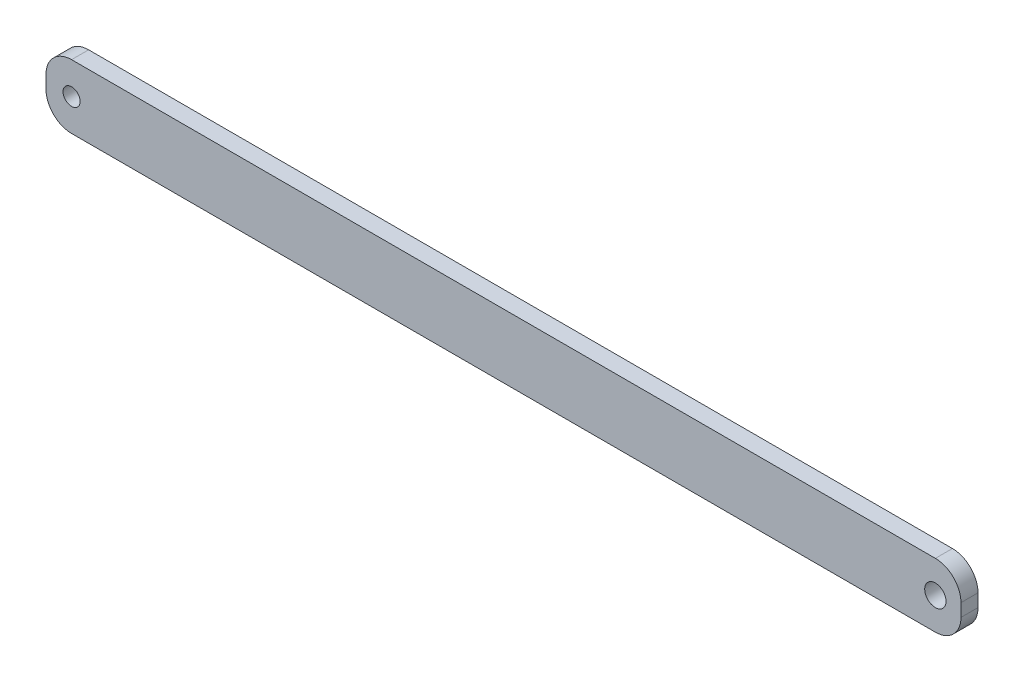
from build123d import *

# Parameters (mm, degrees)
SKETCH1_R           = 3.175
SKETCH1_R_2         = 2.54
BOSS_EXTRUDE1_DEPTH = 5.08


with BuildPart() as part:
    # Sketch1 → Boss-Extrude1 (new body)
    with BuildSketch(Plane.XY):
        with BuildLine():
            Line((7.62, 0), (264.922, 0))
            ThreePointArc((264.922, 0), (270.310153673, 2.231846327), (272.542, 7.62))
            Line((272.542, 7.62), (272.542, 11.43))
            ThreePointArc((272.542, 11.43), (270.310153673, 16.818153673), (264.922, 19.05))
            Line((264.922, 19.05), (7.62, 19.05))
            ThreePointArc((7.62, 19.05), (2.231846327, 16.818153673), (0, 11.43))
            Line((0, 11.43), (0, 7.62))
            ThreePointArc((0, 7.62), (2.231846327, 2.231846327), (7.62, 0))
        make_face()
        with Locations((264.922, 9.525)):
            Circle(SKETCH1_R, mode=Mode.SUBTRACT)
        with Locations((7.62, 9.525)):
            Circle(SKETCH1_R_2, mode=Mode.SUBTRACT)
    extrude(amount=BOSS_EXTRUDE1_DEPTH)


solid = part.part
